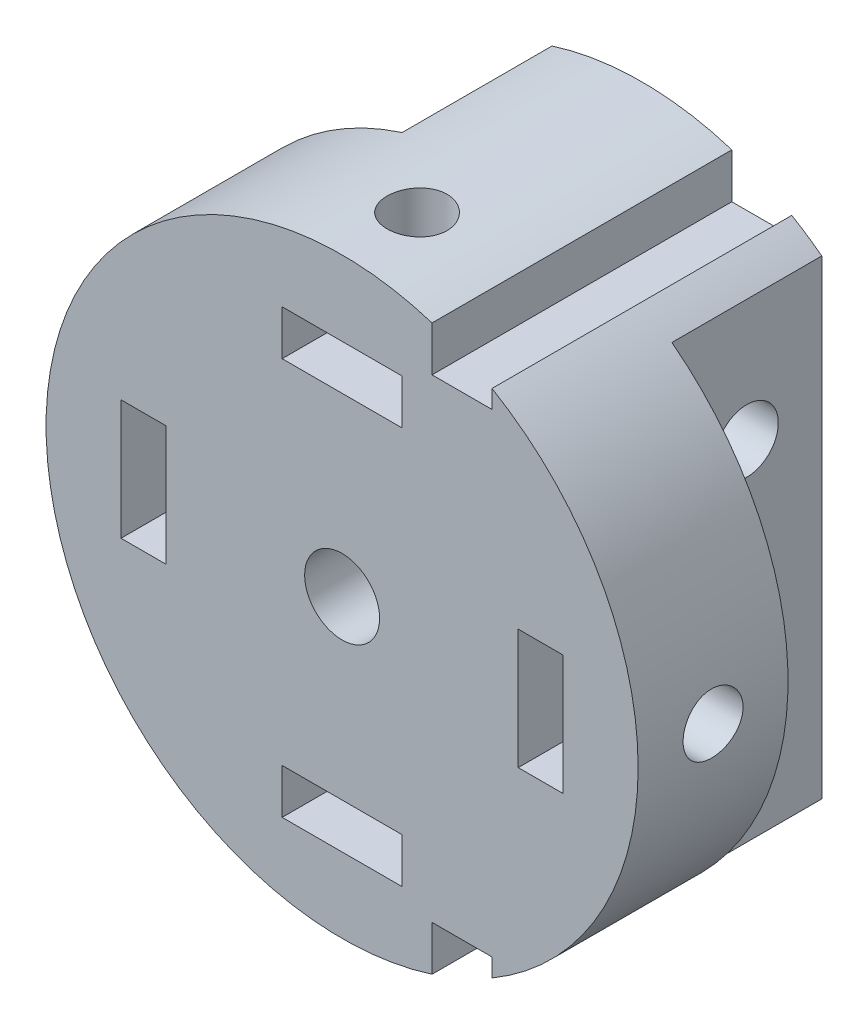
from build123d import *

# Parameters (mm, degrees)
SKETCH3_R                    = 25.0825
SKETCH3_R_2                  = 3.175
BASE_DEPTH                   = 12.7
UPPER_BOLTS_CONNECTION_START = 12.7
SKETCH6_R                    = 3.175
UPPER_BOLTS_CONNECTION_DEPTH = 12.7
NUT_HOLE_DEPTH               = 8.89
UPPER_BOLTHOLES_REACH        = 45.126
SKETCH9_R                    = 2.667
NUT_RECESS_START             = -6.35
NUT_RECESS_DEPTH             = 3.81
SKETCH14_R                   = 2.54
RADIAL_BOLT_HOLE_DEPTH       = 15.24
CIRPATTERN2_COUNT            = 4
WIRE_PASSTHROUGH_REACH       = 45.628
SKETCH15_W                   = 5.08
SKETCH15_H                   = 3.81


with BuildPart() as part:
    # Sketch3 → base (new body)
    with BuildSketch(Plane(origin=(0, 0, 0), x_dir=(0, 1, 0), z_dir=(0, 0, 1))):
        Circle(SKETCH3_R)
        Circle(SKETCH3_R_2, mode=Mode.SUBTRACT)
    extrude(amount=BASE_DEPTH)

    # Sketch6 → upper_bolts_connection (add)
    with BuildSketch(Plane(origin=(0, 0, 0), x_dir=(1, 0, 0), z_dir=(0, 0, -1)).offset(UPPER_BOLTS_CONNECTION_START)):
        with BuildLine():
            Line((15.24, 19.921701891), (15.24, -19.921701891))
            ThreePointArc((15.24, -19.921701891), (4.29731101, -24.711635404), (-7.62, -23.897016681))
            Line((-7.62, -23.897016681), (-7.62, 23.897016681))
            ThreePointArc((-7.62, 23.897016681), (4.29731101, 24.711635404), (15.24, 19.921701891))
        make_face()
        Circle(SKETCH6_R, mode=Mode.SUBTRACT)
    extrude(amount=-UPPER_BOLTS_CONNECTION_DEPTH)

    # Sketch8 → nut_hole (cut)
    with BuildSketch(Plane(origin=(0, 0, -12.7), x_dir=(1, 0, 0), z_dir=(0, 0, -1))):
        Polygon((6.599113577, 0), (3.299556788, 5.715), (-3.299556788, 5.715), (-6.599113577, 0), (-3.299556788, -5.715), (3.299556788, -5.715), align=None)
    extrude(amount=-NUT_HOLE_DEPTH, mode=Mode.SUBTRACT)

    # Sketch9 → upper_boltholes (cut, up to next)
    with BuildSketch(Plane.ZY.offset(7.62), mode=Mode.PRIVATE) as upper_boltholes_sk1:
        with Locations((-6.35, -9.525)):
            Circle(SKETCH9_R)
    upper_boltholes_tool1 = extrude(upper_boltholes_sk1.sketch, amount=-UPPER_BOLTHOLES_REACH, mode=Mode.PRIVATE) & part.part
    # Sketch9 → upper_boltholes (cut, up to next)
    with BuildSketch(Plane.ZY.offset(7.62), mode=Mode.PRIVATE) as upper_boltholes_sk2:
        with Locations((-6.35, 9.525)):
            Circle(SKETCH9_R)
    upper_boltholes_tool2 = extrude(upper_boltholes_sk2.sketch, amount=-UPPER_BOLTHOLES_REACH, mode=Mode.PRIVATE) & part.part
    add(upper_boltholes_tool1.solids().sort_by_distance((-7.62, -9.525, -6.35))[0], mode=Mode.SUBTRACT)
    add(upper_boltholes_tool2.solids().sort_by_distance((-7.62, 9.525, -6.35))[0], mode=Mode.SUBTRACT)

    # Sketch13 → nut_recess (cut)
    with BuildSketch(Plane.ZY.offset(25.0825).offset(NUT_RECESS_START)):
        Polygon((3.417060633, 5.08), (0.484121265, 0), (3.417060633, -5.08), (12.7, -5.08), (12.7, 5.08), align=None)
    nut_recess = extrude(amount=-NUT_RECESS_DEPTH, mode=Mode.SUBTRACT)

    # Sketch14 → radial_bolt_hole (cut)
    with BuildSketch(Plane.ZY.offset(25.0825)):
        with Locations((6.35, 0)):
            Circle(SKETCH14_R)
    radial_bolt_hole = extrude(amount=-RADIAL_BOLT_HOLE_DEPTH, mode=Mode.SUBTRACT)

    # CirPattern2: nut_recess, radial_bolt_hole ×4 about axis
    cirpattern2_axis = Axis((0, 0, 12.7), (0, 0, -1))
    add([nut_recess.rotate(cirpattern2_axis, i * 360 / CIRPATTERN2_COUNT) for i in range(1, CIRPATTERN2_COUNT)], mode=Mode.SUBTRACT)
    add([radial_bolt_hole.rotate(cirpattern2_axis, i * 360 / CIRPATTERN2_COUNT) for i in range(1, CIRPATTERN2_COUNT)], mode=Mode.SUBTRACT)

    # Sketch15 → wire_passthrough (cut, up to next)
    with BuildSketch(Plane(origin=(0, 0, -12.7), x_dir=(1, 0, 0), z_dir=(0, 0, -1)), mode=Mode.PRIVATE) as wire_passthrough_sk1:
        with Locations((10.16, 21.992016681)):
            Rectangle(SKETCH15_W, SKETCH15_H)
    wire_passthrough_tool1 = extrude(wire_passthrough_sk1.sketch, amount=-WIRE_PASSTHROUGH_REACH, mode=Mode.PRIVATE) & part.part
    wire_passthrough = wire_passthrough_tool1.solids().sort_by_distance((10.16, -21.992017, -12.7))[0]
    add(wire_passthrough, mode=Mode.SUBTRACT)

    # wire_passthrough_mirror: wire_passthrough across plane
    add(wire_passthrough.mirror(Plane.ZX), mode=Mode.SUBTRACT)


solid = part.part
